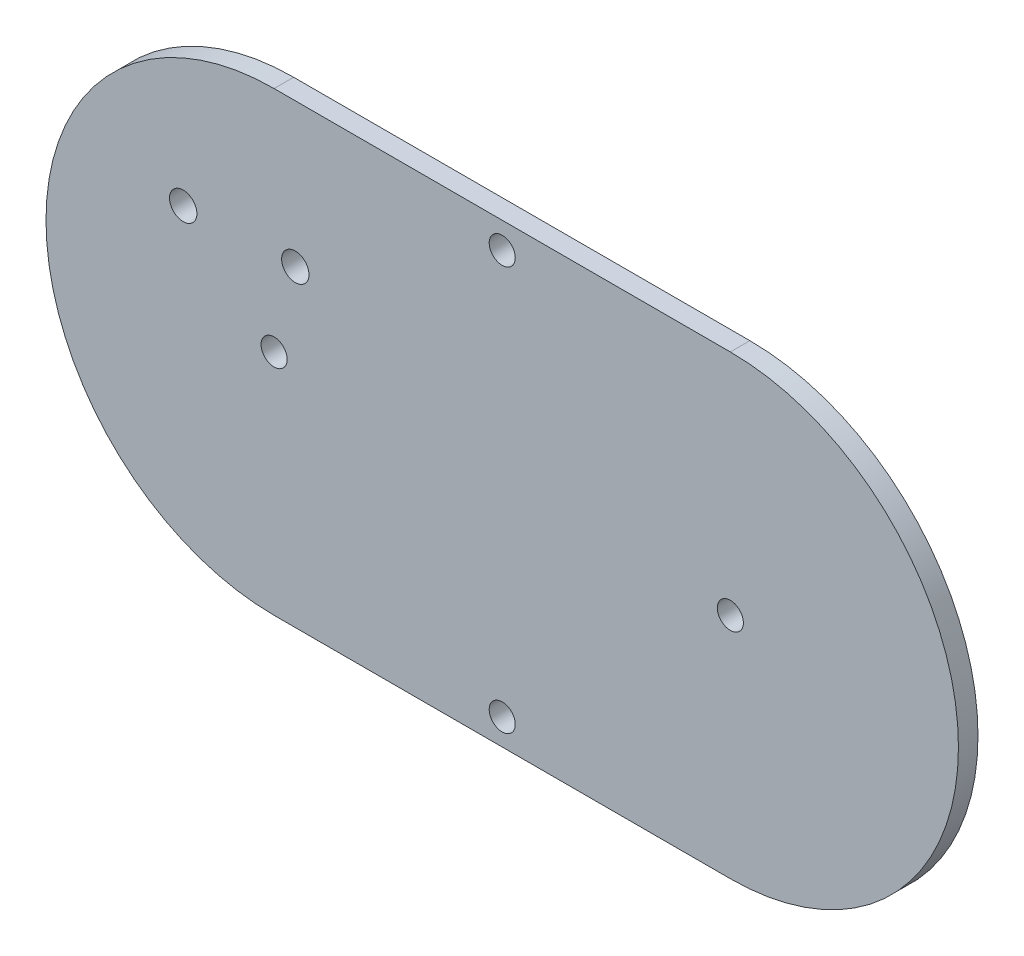
from build123d import *

# Parameters (mm, degrees)
SKETCH1_R           = 2
SKETCH1_R_2         = 2.099997394
SKETCH1_R_3         = 2.100000418
BOSS_EXTRUDE1_DEPTH = 3


with BuildPart() as part:
    # Sketch1 → Boss-Extrude1 (new body)
    with BuildSketch(Plane.XY):
        with BuildLine():
            Line((243.514566495, 346.287321237), (313.514566495, 346.287321237))
            ThreePointArc((313.514566495, 346.287321237), (348.514566495, 311.287321237), (313.514566495, 276.287321237))
            Line((313.514566495, 276.287321237), (243.514566495, 276.287321237))
            ThreePointArc((243.514566495, 276.287321237), (208.514566495, 311.287321237), (243.514566495, 346.287321237))
        make_face()
        with Locations((243.514566495, 311.287321237)):
            Circle(SKETCH1_R, mode=Mode.SUBTRACT)
        with Locations((313.514566495, 311.287321237)):
            Circle(SKETCH1_R, mode=Mode.SUBTRACT)
        with Locations((246.764562225, 324.225588056)):
            Circle(SKETCH1_R_2, mode=Mode.SUBTRACT)
        with Locations((229.564568056, 323.725595013)):
            Circle(SKETCH1_R_3, mode=Mode.SUBTRACT)
        with Locations((278.514566495, 342.287321237)):
            Circle(SKETCH1_R, mode=Mode.SUBTRACT)
        with Locations((278.514566495, 280.287321237)):
            Circle(SKETCH1_R, mode=Mode.SUBTRACT)
    extrude(amount=BOSS_EXTRUDE1_DEPTH)


solid = part.part
